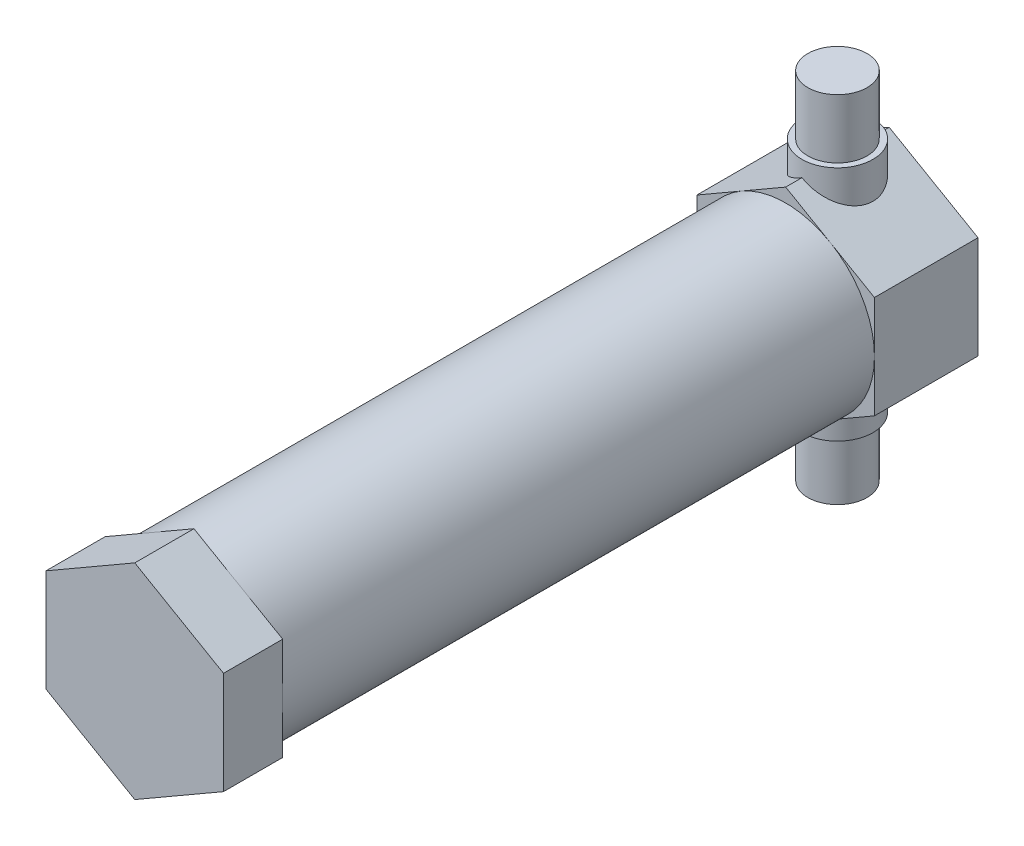
from build123d import *

# Parameters (mm, degrees)
SKETCH6_R           = 9.525
BOSS_EXTRUDE5_DEPTH = 80.9625
BOSS_EXTRUDE6_DEPTH = 6.35
BOSS_EXTRUDE7_DEPTH = 11.1125
SKETCH9_R           = 3.175
BOSS_EXTRUDE8_DEPTH = 19.05
SKETCH11_R          = 3.81
BOSS_EXTRUDE9_DEPTH = 12.7
SKETCH12_R          = 6.35
CUT_EXTRUDE2_DEPTH  = 50.8


with BuildPart() as part:
    # Sketch6 → Boss-Extrude5 (new body)
    with BuildSketch(Plane.XY):
        Circle(SKETCH6_R)
    extrude(amount=BOSS_EXTRUDE5_DEPTH)

    # Sketch7 → Boss-Extrude6 (add)
    with BuildSketch(Plane.XY.offset(80.9625)):
        Polygon((0, 10.998522628), (-9.525, 5.499261314), (-9.525, -5.499261314), (0, -10.998522628), (9.525, -5.499261314), (9.525, 5.499261314), align=None)
    extrude(amount=-BOSS_EXTRUDE6_DEPTH)

    # Sketch8 → Boss-Extrude7 (add)
    with BuildSketch(Plane(origin=(0, 0, 0), x_dir=(-1, 0, 0), z_dir=(0, 0, -1))):
        Polygon((0, 10.998522628), (-9.525, 5.499261314), (-9.525, -5.499261314), (0, -10.998522628), (9.525, -5.499261314), (9.525, 5.499261314), align=None)
    extrude(amount=-BOSS_EXTRUDE7_DEPTH)

    # Sketch9 → Boss-Extrude8 (add, symmetric)
    with BuildSketch(Plane(origin=(0, 0, 0), x_dir=(1, 0, 0), z_dir=(0, 1, 0))):
        with Locations((0, -5.55625)):
            Circle(SKETCH9_R)
    extrude(amount=BOSS_EXTRUDE8_DEPTH, both=True)

    # Sketch11 → Boss-Extrude9 (add, symmetric)
    with BuildSketch(Plane(origin=(0, 0, 0), x_dir=(1, 0, 0), z_dir=(0, 1, 0))):
        with Locations((0, -5.55625)):
            Circle(SKETCH11_R)
    extrude(amount=BOSS_EXTRUDE9_DEPTH, both=True)

    # Sketch12 → Cut-Extrude2 (cut)
    with BuildSketch(Plane(origin=(0, 0, 0), x_dir=(-1, 0, 0), z_dir=(0, 0, -1))):
        Circle(SKETCH12_R)
    extrude(amount=-CUT_EXTRUDE2_DEPTH, mode=Mode.SUBTRACT)


solid = part.part
